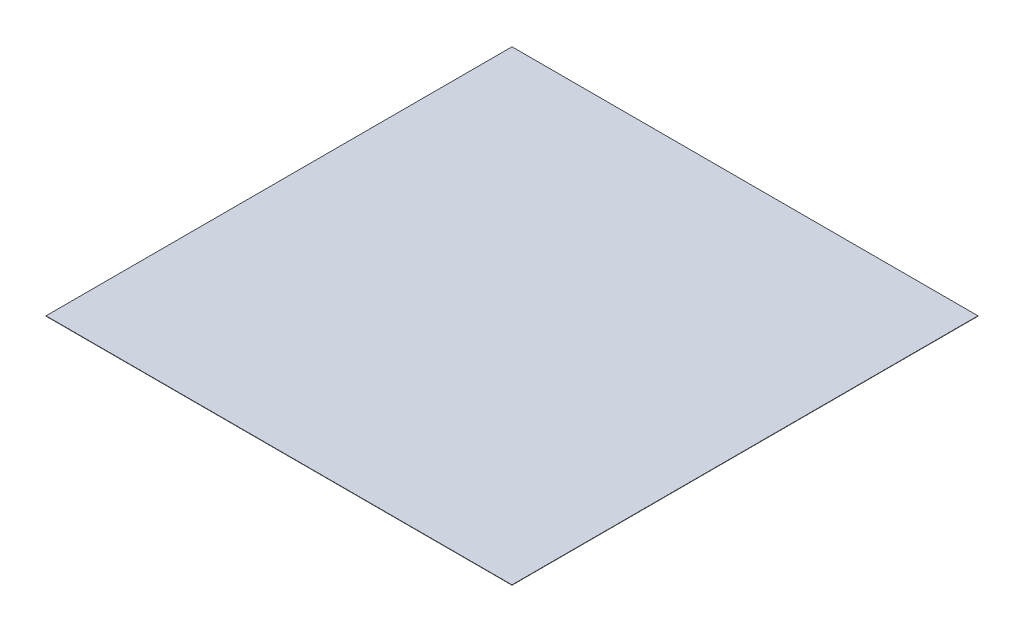
from build123d import *

# Parameters (mm, degrees)
SKETCH1_W           = 1500
SKETCH1_H           = 1500
BOSS_EXTRUDE1_DEPTH = 1


with BuildPart() as part:
    # Sketch1 → Boss-Extrude1 (new body)
    with BuildSketch(Plane(origin=(0, 0, 0), x_dir=(1, 0, 0), z_dir=(0, 1, 0))):
        with Locations((750, 750)):
            Rectangle(SKETCH1_W, SKETCH1_H)
    extrude(amount=BOSS_EXTRUDE1_DEPTH)


solid = part.part
